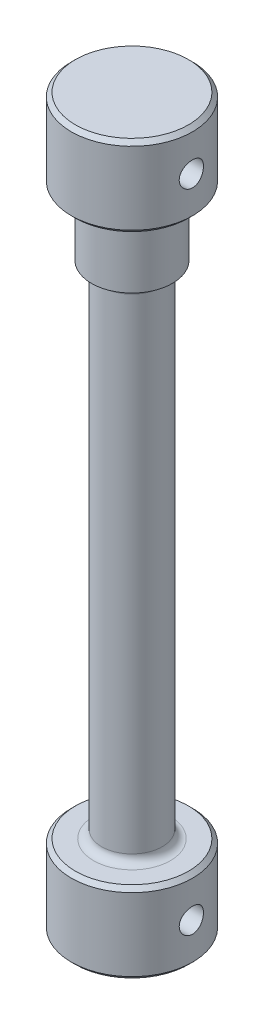
from build123d import *

# Parameters (mm, degrees)
ESQUISSE2_R             = 3
ENL_V_MAT_EXTRU_1_DEPTH = 25


with BuildPart() as part:
    # Esquisse1 → Base-Révolution (revolve)
    with BuildSketch(Plane.XY):
        with BuildLine():
            Line((0, 0), (-14, 0))
            Line((-14, 0), (-15, -1))
            Line((-15, -1), (-15, -19))
            Line((-15, -19), (-14, -20))
            Line((-14, -20), (-12, -20))
            ThreePointArc((-12, -20), (-10.585786438, -20.585786438), (-10, -22))
            Line((-10, -22), (-10, -36))
            Line((-10, -36), (-9.5, -36))
            ThreePointArc((-9.5, -36), (-8.085786438, -36.585786438), (-7.5, -38))
            Line((-7.5, -38), (-7.5, -158))
            ThreePointArc((-7.5, -158), (-8.085786438, -159.414213562), (-9.5, -160))
            Line((-9.5, -160), (-14, -160))
            Line((-14, -160), (-15, -161))
            Line((-15, -161), (-15, -179))
            Line((-15, -179), (-14, -180))
            Line((-14, -180), (0, -180))
            Line((0, -180), (0, 0))
        make_face()
    revolve(axis=Axis((0, 0, 0), (0, -1, 0)))

    # Esquisse2 → Enlèv. mat.-Extru.1 (cut, symmetric)
    with BuildSketch(Plane(origin=(0, 0, 0), x_dir=(0, 0, -1), z_dir=(1, 0, 0))):
        with Locations((0, -10)):
            Circle(ESQUISSE2_R)
        with Locations((0, -170)):
            Circle(ESQUISSE2_R)
    extrude(amount=ENL_V_MAT_EXTRU_1_DEPTH, both=True, mode=Mode.SUBTRACT)


solid = part.part
